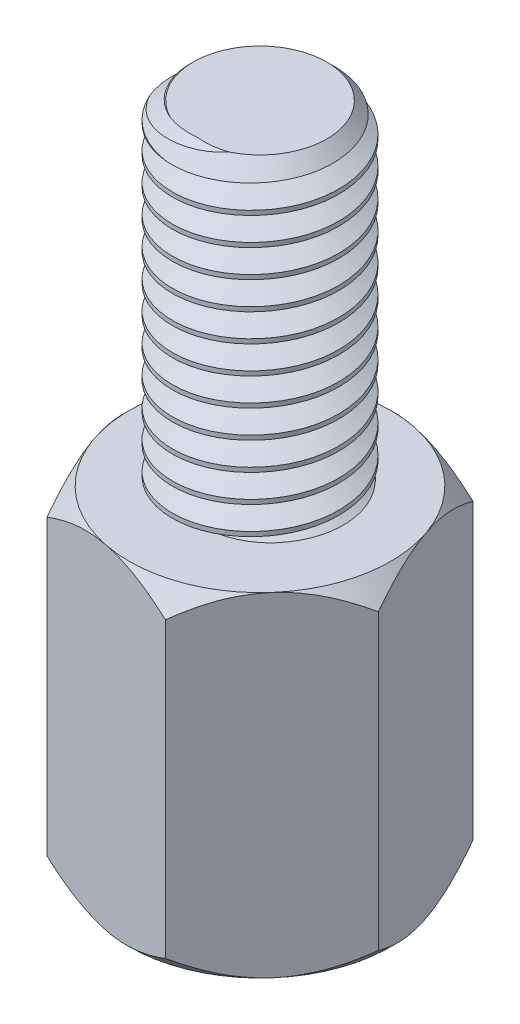
from build123d import *

# Parameters (mm, degrees)
BOSS_EXTRUDE3_DEPTH       = 6
SKETCH17_R                = 1.5
BOSS_EXTRUDE4_DEPTH       = 6
CHAMFER3_SIZE             = 0.3
CUT_SWEEP7_PITCH          = 0.5
CUT_SWEEP7_TO             = 8
M3X0_5_TAPPED_HOLE1_D     = 2.5
M3X0_5_TAPPED_HOLE1_DEPTH = 5
M3X0_5_TAPPED_HOLE1_TIP   = 0.751075774


with BuildPart() as part:
    # Sketch8 → Boss-Extrude3 (new body)
    with BuildSketch(Plane(origin=(0, 0, 0), x_dir=(1, 0, 0), z_dir=(0, 1, 0))):
        Polygon((-0.870268393, 2.570207435), (-2.660999128, 0.531429181), (-1.790730735, -2.038778253), (0.870268393, -2.570207435), (2.660999128, -0.531429181), (1.790730735, 2.038778253), align=None)
    extrude(amount=BOSS_EXTRUDE3_DEPTH)

    # Cut-Sweep3: sweep along a path in Sketch10
    with BuildLine(Plane(origin=(0, 6, 0), x_dir=(1, 0, 0), z_dir=(0, 1, 0))) as cut_sweep3_path:
        CenterArc((0, 0), 2.35, 0, 360)
    # Sketch16 → Cut-Sweep3 (sweep, cut)
    with BuildSketch(Plane(origin=(0, 0, 0), x_dir=(0, -1, 0), z_dir=(0.9471765666383551, 0, -0.3207125685269878))):
        Polygon((-6, 2.713546265), (-6, 2.350046265), (-5.6365, 2.713546265), align=None)
    sweep(path=cut_sweep3_path.line, mode=Mode.SUBTRACT)

    # Cut-Sweep4: sweep along a path in Sketch9
    with BuildLine(Plane(origin=(0, 0, 0), x_dir=(-1, 0, 0), z_dir=(0, -1, 0))) as cut_sweep4_path:
        CenterArc((0, 0), 2.35, 0, 360)
    # Sketch15 → Cut-Sweep4 (sweep, cut)
    with BuildSketch(Plane(origin=(0, 0, 0), x_dir=(0, -1, 0), z_dir=(0.9471765666383551, 0, -0.3207125685269878))):
        Polygon((0, 2.713546265), (0, 2.350046265), (-0.3635, 2.713546265), align=None)
    sweep(path=cut_sweep4_path.line, mode=Mode.SUBTRACT)

    # Sketch17 → Boss-Extrude4 (add)
    with BuildSketch(Plane(origin=(0, 6, 0), x_dir=(1, 0, 0), z_dir=(0, 1, 0))):
        with Locations(Location((0, 0, 0), (0, 0, 270))):
            Circle(SKETCH17_R)
    extrude(amount=BOSS_EXTRUDE4_DEPTH)

    # Chamfer3
    chamfer3_edges = [part.edges().sort_by_distance(p)[0] for p in [
        (0, 12, -1.5),
    ]]
    chamfer(chamfer3_edges, length=CHAMFER3_SIZE)

    # Cut-Sweep7: arcs per turn and ends read off the stored shape
    # Cut-Sweep7: the profile of Sketch20 screwed along a right-hand helix through 17 turns, 6 arcs to a turn; built about Z, then put on its axis
    cut_sweep7_z = Axis((0, 0, 0), (0, 0, 1))
    cut_sweep7_corners = [(1.819643346, 0, 0.394412995), (1.1365, 0, 0), (1.819643346, 0, -0.394412995)]
    with BuildLine(mode=Mode.PRIVATE) as cut_sweep7_profile:
        Line(cut_sweep7_corners[0], cut_sweep7_corners[1])
        Line(cut_sweep7_corners[1], cut_sweep7_corners[2])
        Line(cut_sweep7_corners[2], cut_sweep7_corners[0])
    cut_sweep7_cap = Face(cut_sweep7_profile.wire())
    cut_sweep7_turn_angles = [0, 30, 60, 90, 120, 150, 180, 210, 240, 270, 300, 330, 360]
    cut_sweep7_turn_weights = [1, 0.8660254037844387, 1, 0.8660254037844387, 1, 0.8660254037844387, 1, 0.8660254037844387, 1, 0.8660254037844387, 1, 0.8660254037844387, 1]
    cut_sweep7_turn_rails = [Edge.make_bspline([Vector(p[0], p[1], 0).rotate(cut_sweep7_z, cut_sweep7_turn_angles[k]) / cut_sweep7_turn_weights[k] + Vector(0, 0, p[2] + CUT_SWEEP7_PITCH * cut_sweep7_turn_angles[k] / 360) for k in range(13)], [0, 0, 0, 1, 1, 2, 2, 3, 3, 4, 4, 5, 5, 6, 6, 6], 2, cut_sweep7_turn_weights) for p in cut_sweep7_corners]
    cut_sweep7_turn_sides = [Face.make_surface_from_curves(cut_sweep7_turn_rails[p[0]], cut_sweep7_turn_rails[p[1]]) for p in [(0, 1), (1, 2), (2, 0)]]
    cut_sweep7_turn = Solid(Shell([*cut_sweep7_turn_sides, cut_sweep7_cap, cut_sweep7_cap.rotate(cut_sweep7_z, 360).moved(Location((0, 0, CUT_SWEEP7_PITCH * 360 / 360)))]))
    cut_sweep7_each = [*[cut_sweep7_turn.moved(Location((0, 0, CUT_SWEEP7_PITCH * i))) for i in range(17)]]
    add(Plane(origin=(0, 14, 0), x_dir=(0, 0, 1), z_dir=(0, -1, 0)) * split(Compound([cut_sweep7_each[i] for i in range(0, 17, 2)]), bisect_by=Plane.XY.offset(CUT_SWEEP7_TO), keep=Keep.BOTTOM, mode=Mode.PRIVATE), mode=Mode.SUBTRACT)
    add(Plane(origin=(0, 14, 0), x_dir=(0, 0, 1), z_dir=(0, -1, 0)) * split(Compound([cut_sweep7_each[i] for i in range(1, 17, 2)]), bisect_by=Plane.XY.offset(CUT_SWEEP7_TO), keep=Keep.BOTTOM, mode=Mode.PRIVATE), mode=Mode.SUBTRACT)

    # M3x0.5 Tapped Hole1
    with Locations(Plane(origin=(0, 0, 0), x_dir=(-1, 0, 0), z_dir=(0, -1, 0))):
        with Locations((0, 0)):
            Hole(M3X0_5_TAPPED_HOLE1_D / 2, depth=M3X0_5_TAPPED_HOLE1_DEPTH)
            with Locations((0, 0, -(M3X0_5_TAPPED_HOLE1_DEPTH + M3X0_5_TAPPED_HOLE1_TIP / 2))):  # 118° drill point
                Cone(0, M3X0_5_TAPPED_HOLE1_D / 2, M3X0_5_TAPPED_HOLE1_TIP, mode=Mode.SUBTRACT)


solid = part.part
